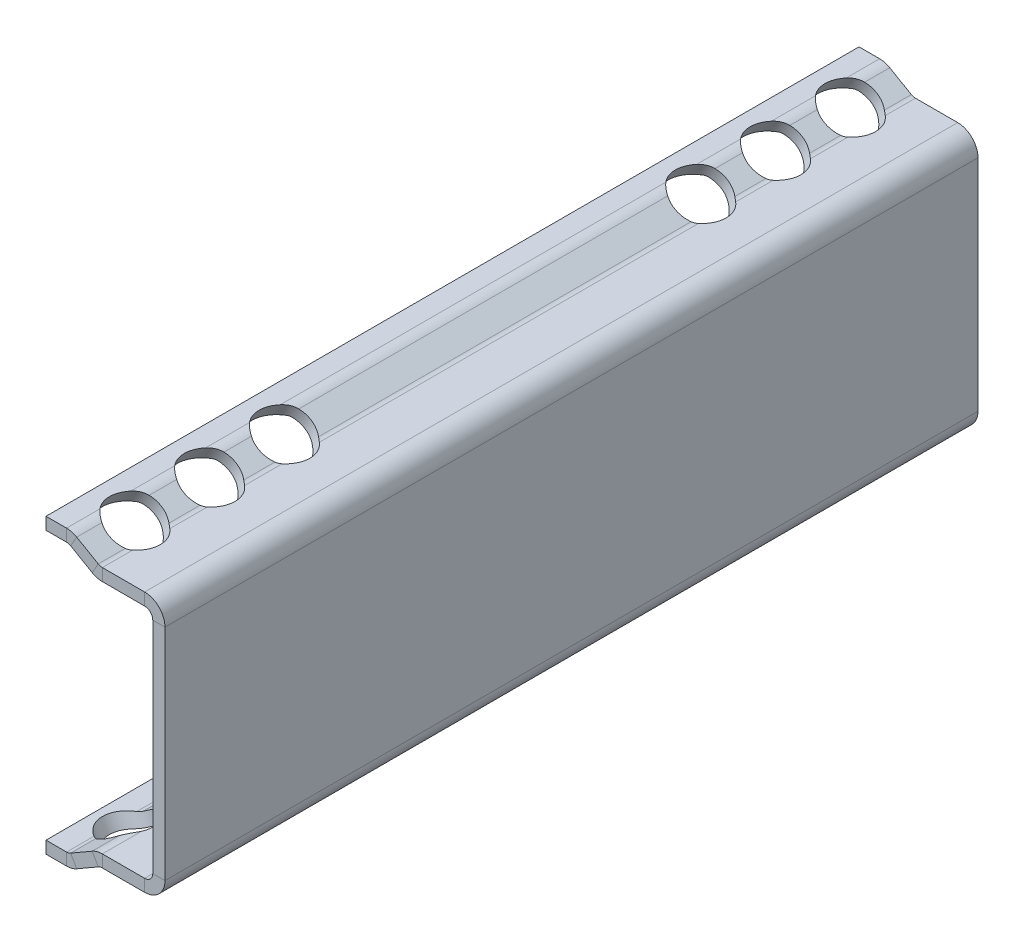
from build123d import *

# Parameters (mm, degrees)
ODGI_CIE_BAZOWE1_DEPTH     = 50
SZKIC6_R                   = 1.6
WYTNIJ_WYCI_GNI_CIE1_DEPTH = 53.969080591


# Sheet-metal steps are written as plain solids
with BuildPart() as part:
    # Szkic1 → Odgięcie bazowe1 (new body)
    with BuildSketch(Plane.XY):
        with BuildLine():
            Line((-7.315765601, -9), (-6.050961894, -9))
            ThreePointArc((-6.050961894, -9), (-5.727438088, -8.957407283), (-5.425961894, -8.832531755))
            Line((-5.425961894, -8.832531755), (-4.1, -8.066987298))
            ThreePointArc((-4.1, -8.066987298), (-3.979409523, -8.017037087), (-3.85, -8))
            Line((-3.85, -8), (-1.25, -8))
            ThreePointArc((-1.25, -8), (-0.366116524, -7.633883476), (0, -6.75))
            Line((0, -6.75), (0, 6.75))
            ThreePointArc((0, 6.75), (-0.366116524, 7.633883476), (-1.25, 8))
            Line((-1.25, 8), (-3.85, 8))
            ThreePointArc((-3.85, 8), (-3.979409523, 8.017037087), (-4.1, 8.066987298))
            Line((-4.1, 8.066987298), (-5.425961894, 8.832531755))
            ThreePointArc((-5.425961894, 8.832531755), (-5.727438088, 8.957407283), (-6.050961894, 9))
            Line((-6.050961894, 9), (-7.315765601, 9))
            Line((-7.315765601, 9), (-7.315765601, 8.25))
            Line((-7.315765601, 8.25), (-6.050961894, 8.25))
            ThreePointArc((-6.050961894, 8.25), (-5.921552372, 8.232962913), (-5.800961894, 8.183012702))
            Line((-5.800961894, 8.183012702), (-4.475, 7.417468245))
            ThreePointArc((-4.475, 7.417468245), (-4.173523806, 7.292592717), (-3.85, 7.25))
            Line((-3.85, 7.25), (-1.25, 7.25))
            ThreePointArc((-1.25, 7.25), (-0.896446609, 7.103553391), (-0.75, 6.75))
            Line((-0.75, 6.75), (-0.75, -6.75))
            ThreePointArc((-0.75, -6.75), (-0.896446609, -7.103553391), (-1.25, -7.25))
            Line((-1.25, -7.25), (-3.85, -7.25))
            ThreePointArc((-3.85, -7.25), (-4.173523806, -7.292592717), (-4.475, -7.417468245))
            Line((-4.475, -7.417468245), (-5.800961894, -8.183012702))
            ThreePointArc((-5.800961894, -8.183012702), (-5.921552372, -8.232962913), (-6.050961894, -8.25))
            Line((-6.050961894, -8.25), (-7.315765601, -8.25))
            Line((-7.315765601, -8.25), (-7.315765601, -9))
        make_face()
    extrude(amount=-ODGI_CIE_BAZOWE1_DEPTH)

    # Szkic6 → Wytnij-wyciągnięcie1 (cut, through all)
    with BuildSketch(Plane(origin=(2.968107966, 5.1409138, 0), x_dir=(0.8660254037844378, -0.5000000000000017, 0), z_dir=(0.5000000000000016, 0.8660254037844377, 0))):
        with Locations(Location((-8.450223208, 3, 0), (0, 0, 114.561182368))):
            Circle(SZKIC6_R)
        with Locations(Location((-8.450223208, 7.6, 0), (0, 0, 114.561182368))):
            Circle(SZKIC6_R)
        with Locations(Location((-8.450223208, 12.2, 0), (0, 0, 114.561182368))):
            Circle(SZKIC6_R)
        with Locations(Location((-8.450223208, 37.8, 0), (0, 0, 245.438817632))):
            Circle(SZKIC6_R)
        with Locations(Location((-8.450223208, 42.4, 0), (0, 0, 114.561182368))):
            Circle(SZKIC6_R)
        with Locations(Location((-8.450223208, 47, 0), (0, 0, 114.561182368))):
            Circle(SZKIC6_R)
    wytnij_wyci_gni_cie1 = extrude(amount=-WYTNIJ_WYCI_GNI_CIE1_DEPTH, mode=Mode.SUBTRACT)

    # Lustro1: Wytnij-wyciągnięcie1 across plane
    add(wytnij_wyci_gni_cie1.mirror(Plane(origin=(0, 0, 0), x_dir=(0, 0, 1), z_dir=(0, -1, 0))), mode=Mode.SUBTRACT)


solid = part.part
